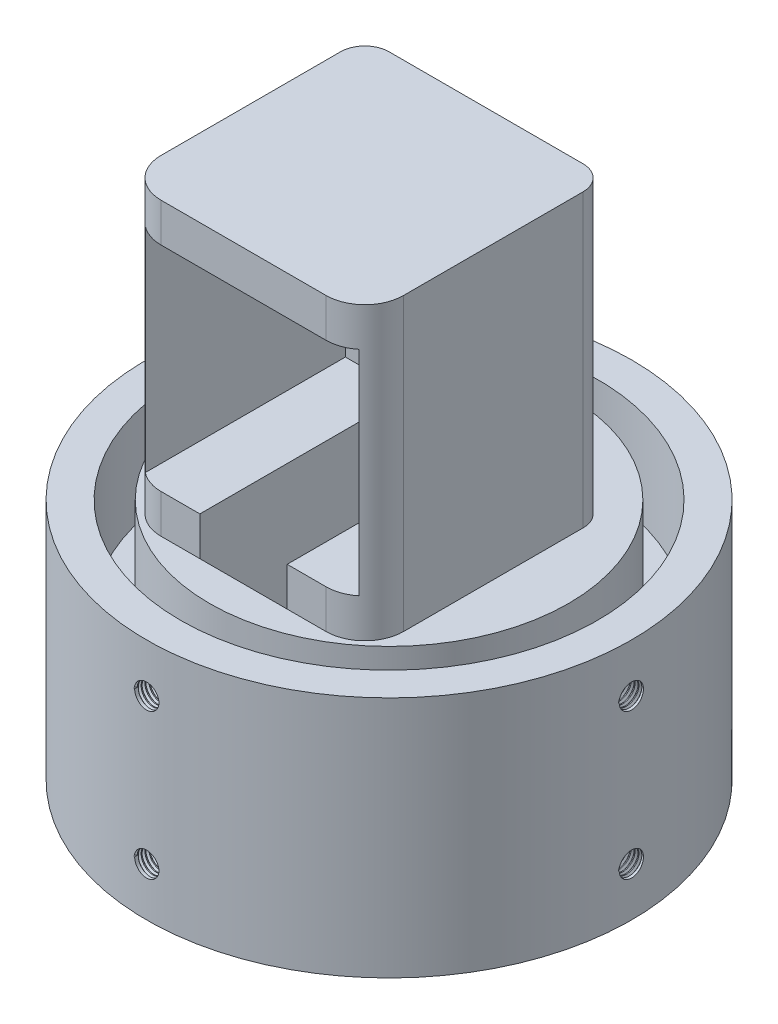
from build123d import *

# Parameters (mm, degrees)
SKETCH1_W                                        = 50
SKETCH1_H                                        = 50
BOSS_EXTRUDE1_DEPTH                              = 60
SKETCH4_W                                        = 44
SKETCH4_H                                        = 44
CUT_EXTRUDE1_DEPTH                               = 43
SKETCH2_R                                        = 50
BOSS_EXTRUDE2_BASE_DEPTH                         = 50
CUT_EXTRUDE3_DEPTH                               = 8
CUT_EXTRUDE3_DEPTH_BACK                          = 1
SKETCH3_M3_LAYOUT_R                              = 11.5
CBORE_FOR_M3_HEX_HEAD_MACHINE_SCREW1_D           = 3.4
CBORE_FOR_M3_HEX_HEAD_MACHINE_SCREW1_CBORE_D     = 8.4
CBORE_FOR_M3_HEX_HEAD_MACHINE_SCREW1_CBORE_DEPTH = 2.3
SKETCH20_W                                       = 18
SKETCH20_H                                       = 43
CUT_EXTRUDE6_WIRE_HOLE_DEPTH                     = 95.281493412
FILLET1_R                                        = 8
FILLET2_R                                        = 5
SKETCH39_PIPE_ALIGNMENT_R                        = 43
SKETCH39_PIPE_ALIGNMENT_R_2                      = 37
CUT_EXTRUDE8_DEPTH                               = 20
SKETCH40_R                                       = 2.5
CUT_EXTRUDE9_DEPTH                               = 11
THREAD1_PITCH                                    = 0.8
THREAD2_PITCH                                    = 0.8
CIRPATTERN6_COUNT                                = 4
THREAD3_PITCH                                    = 0.8
THREAD4_PITCH                                    = 0.8
THREAD6_PITCH                                    = 0.8
THREAD7_PITCH                                    = 0.8
THREAD8_PITCH                                    = 0.8
THREAD9_PITCH                                    = 0.8


with BuildPart() as part:
    # Sketch1 → Boss-Extrude1 (new body)
    with BuildSketch(Plane(origin=(0, 0, 0), x_dir=(1, 0, 0), z_dir=(0, 1, 0))):
        Rectangle(SKETCH1_W, SKETCH1_H)
    extrude(amount=BOSS_EXTRUDE1_DEPTH)

    # Sketch4 → Cut-Extrude1 (cut)
    with BuildSketch(Plane.XY.offset(25)):
        with Locations((0, 30)):
            Rectangle(SKETCH4_W, SKETCH4_H)
    extrude(amount=-CUT_EXTRUDE1_DEPTH, mode=Mode.SUBTRACT)

    # Sketch2 → Boss-Extrude2- Base (add)
    with BuildSketch(Plane(origin=(0, 0, 0), x_dir=(-1, 0, 0), z_dir=(0, -1, 0))):
        with Locations(Location((0, 5, 0), (0, 0, 90))):
            Circle(SKETCH2_R)
    extrude(amount=BOSS_EXTRUDE2_BASE_DEPTH)

    # Sketch3 - M3 Layout → Cut-Extrude3 (cut, two sides: drawn at the far end of the back side and taken through both)
    with BuildSketch(Plane.XY.offset(-25).offset(-CUT_EXTRUDE3_DEPTH_BACK)):
        with Locations((0, 30)):
            Circle(SKETCH3_M3_LAYOUT_R)
    extrude(amount=CUT_EXTRUDE3_DEPTH + CUT_EXTRUDE3_DEPTH_BACK, mode=Mode.SUBTRACT)

    # CBORE for M3 Hex Head Machine Screw1 (through all)
    with Locations(Plane(origin=(0, 0, -25), x_dir=(-1, 0, 0), z_dir=(0, 0, -1))):
        with Locations((-15.5, 45.5), (15.5, 45.5), (15.5, 14.5), (-15.5, 14.5)):
            CounterBoreHole(CBORE_FOR_M3_HEX_HEAD_MACHINE_SCREW1_D / 2, CBORE_FOR_M3_HEX_HEAD_MACHINE_SCREW1_CBORE_D / 2, CBORE_FOR_M3_HEX_HEAD_MACHINE_SCREW1_CBORE_DEPTH)

    # Sketch20 → Cut-Extrude6- Wire Hole (cut, through all)
    with BuildSketch(Plane(origin=(0, 8, 0), x_dir=(1, 0, 0), z_dir=(0, 1, 0))):
        with Locations((0, -3.5)):
            Rectangle(SKETCH20_W, SKETCH20_H)
    extrude(amount=-CUT_EXTRUDE6_WIRE_HOLE_DEPTH, mode=Mode.SUBTRACT)

    # Fillet1
    # the kernel refuses this fillet: 8 mm, written as the material it takes off along each edge
    with BuildSketch(Plane(origin=(25, 0, 25), x_dir=(0, 0, -1), z_dir=(0, 1, 0)), Plane(origin=(-25, 0, 25), x_dir=(1, 0, 0), z_dir=(0, 1, 0))) as fillet1_piece_1:
        with BuildLine():
            CenterArc((FILLET1_R, FILLET1_R), FILLET1_R, 180, 90)
            Line((0, FILLET1_R), (0, 0))
            Line((0, 0), (FILLET1_R, 0))
        make_face()
    extrude(amount=80, mode=Mode.SUBTRACT)

    # Fillet2
    fillet2_edges = [part.edges().sort_by_distance(p)[0] for p in [
        (-25, 30, -25),
        (25, 30, -25),
    ]]
    fillet(fillet2_edges, radius=FILLET2_R)

    # Sketch39- Pipe Alignment → Cut-Extrude8 (cut)
    with BuildSketch(Plane(origin=(0, 0, 0), x_dir=(1, 0, 0), z_dir=(0, 1, 0))):
        with Locations(Location((0, 5, 0), (0, 0, 270))):
            Circle(SKETCH39_PIPE_ALIGNMENT_R)
        with Locations(Location((0, 5, 0), (0, 0, 270))):
            Circle(SKETCH39_PIPE_ALIGNMENT_R_2, mode=Mode.SUBTRACT)
    cut_extrude8 = extrude(amount=-CUT_EXTRUDE8_DEPTH, mode=Mode.SUBTRACT)

    # Mirror1: Cut-Extrude8 across plane
    add(cut_extrude8.mirror(Plane.ZX.offset(-25)), mode=Mode.SUBTRACT)

    # Sketch40 → Cut-Extrude9 (cut)
    with BuildSketch(Plane.XY.offset(45)):
        with Locations(Location((0, -10, 0), (0, 0, 270))):
            Circle(SKETCH40_R)
        with Locations(Location((0, -40, 0), (0, 0, 269.999999966))):
            Circle(SKETCH40_R)
    cut_extrude9 = extrude(amount=-CUT_EXTRUDE9_DEPTH, mode=Mode.SUBTRACT)

    # Thread1: arcs per turn and ends read off the stored shape
    # Thread1: the profile of Thread Profile1 profile screwed along a right-hand helix through 12.5 turns, 8 arcs to a turn; built about Z, then put on its axis
    thread1_z = Axis((0, 0, 0), (0, 0, 1))
    thread1_corners = [(2.4997, 0, -0.000173205), (2.9330127, 0, 0.249999999), (2.9330127, 0, 0.349999999), (2.4997, 0, 0.600173203)]
    with BuildLine(mode=Mode.PRIVATE) as thread1_profile:
        Line(thread1_corners[0], thread1_corners[1])
        Line(thread1_corners[1], thread1_corners[2])
        Line(thread1_corners[2], thread1_corners[3])
        Line(thread1_corners[3], thread1_corners[0])
    thread1_cap = Face(thread1_profile.wire())
    thread1_turn_angles = [0, 22.5, 45, 67.5, 90, 112.5, 135, 157.5, 180, 202.5, 225, 247.5, 270, 292.5, 315, 337.5, 360]
    thread1_turn_weights = [1, 0.9238795325112867, 1, 0.9238795325112867, 1, 0.9238795325112867, 1, 0.9238795325112867, 1, 0.9238795325112867, 1, 0.9238795325112867, 1, 0.9238795325112867, 1, 0.9238795325112867, 1]
    thread1_turn_rails = [Edge.make_bspline([Vector(p[0], p[1], 0).rotate(thread1_z, thread1_turn_angles[k]) / thread1_turn_weights[k] + Vector(0, 0, p[2] + THREAD1_PITCH * thread1_turn_angles[k] / 360) for k in range(17)], [0, 0, 0, 1, 1, 2, 2, 3, 3, 4, 4, 5, 5, 6, 6, 7, 7, 8, 8, 8], 2, thread1_turn_weights) for p in thread1_corners]
    thread1_turn_sides = [Face.make_surface_from_curves(thread1_turn_rails[p[0]], thread1_turn_rails[p[1]]) for p in [(0, 1), (1, 2), (2, 3), (3, 0)]]
    thread1_last_angles = [4320, 4342.5, 4365, 4387.5, 4410, 4432.5, 4455, 4477.5, 4500]
    thread1_last_weights = [1, 0.9238795325112867, 1, 0.9238795325112867, 1, 0.9238795325112867, 1, 0.9238795325112867, 1]
    thread1_last_rails = [Edge.make_bspline([Vector(p[0], p[1], 0).rotate(thread1_z, thread1_last_angles[k]) / thread1_last_weights[k] + Vector(0, 0, p[2] + THREAD1_PITCH * thread1_last_angles[k] / 360) for k in range(9)], [0, 0, 0, 1, 1, 2, 2, 3, 3, 4, 4, 4], 2, thread1_last_weights) for p in thread1_corners]
    thread1_last_sides = [Face.make_surface_from_curves(thread1_last_rails[p[0]], thread1_last_rails[p[1]]) for p in [(0, 1), (1, 2), (2, 3), (3, 0)]]
    thread1 = Plane(origin=(0, -10, 45), x_dir=(-1, 0, 0), z_dir=(0, 0, -1)) * Solid(Shell([*[p.moved(Location((0, 0, THREAD1_PITCH * i))) for i in range(12) for p in thread1_turn_sides], *thread1_last_sides, thread1_cap, thread1_cap.rotate(thread1_z, 4500).moved(Location((0, 0, THREAD1_PITCH * 4500 / 360)))]))
    add(thread1, mode=Mode.SUBTRACT)

    # Thread2: arcs per turn and ends read off the stored shape
    # Thread2: the profile of Thread Profile2 profile screwed along a right-hand helix through 12.5 turns, 8 arcs to a turn; built about Z, then put on its axis
    thread2_z = Axis((0, 0, 0), (0, 0, 1))
    thread2_corners = [(2.4997, 0, -0.000173205), (2.9330127, 0, 0.249999999), (2.9330127, 0, 0.349999999), (2.4997, 0, 0.600173203)]
    with BuildLine(mode=Mode.PRIVATE) as thread2_profile:
        Line(thread2_corners[0], thread2_corners[1])
        Line(thread2_corners[1], thread2_corners[2])
        Line(thread2_corners[2], thread2_corners[3])
        Line(thread2_corners[3], thread2_corners[0])
    thread2_cap = Face(thread2_profile.wire())
    thread2_turn_angles = [0, 22.5, 45, 67.5, 90, 112.5, 135, 157.5, 180, 202.5, 225, 247.5, 270, 292.5, 315, 337.5, 360]
    thread2_turn_weights = [1, 0.9238795325112867, 1, 0.9238795325112867, 1, 0.9238795325112867, 1, 0.9238795325112867, 1, 0.9238795325112867, 1, 0.9238795325112867, 1, 0.9238795325112867, 1, 0.9238795325112867, 1]
    thread2_turn_rails = [Edge.make_bspline([Vector(p[0], p[1], 0).rotate(thread2_z, thread2_turn_angles[k]) / thread2_turn_weights[k] + Vector(0, 0, p[2] + THREAD2_PITCH * thread2_turn_angles[k] / 360) for k in range(17)], [0, 0, 0, 1, 1, 2, 2, 3, 3, 4, 4, 5, 5, 6, 6, 7, 7, 8, 8, 8], 2, thread2_turn_weights) for p in thread2_corners]
    thread2_turn_sides = [Face.make_surface_from_curves(thread2_turn_rails[p[0]], thread2_turn_rails[p[1]]) for p in [(0, 1), (1, 2), (2, 3), (3, 0)]]
    thread2_last_angles = [4320, 4342.5, 4365, 4387.5, 4410, 4432.5, 4455, 4477.5, 4500]
    thread2_last_weights = [1, 0.9238795325112867, 1, 0.9238795325112867, 1, 0.9238795325112867, 1, 0.9238795325112867, 1]
    thread2_last_rails = [Edge.make_bspline([Vector(p[0], p[1], 0).rotate(thread2_z, thread2_last_angles[k]) / thread2_last_weights[k] + Vector(0, 0, p[2] + THREAD2_PITCH * thread2_last_angles[k] / 360) for k in range(9)], [0, 0, 0, 1, 1, 2, 2, 3, 3, 4, 4, 4], 2, thread2_last_weights) for p in thread2_corners]
    thread2_last_sides = [Face.make_surface_from_curves(thread2_last_rails[p[0]], thread2_last_rails[p[1]]) for p in [(0, 1), (1, 2), (2, 3), (3, 0)]]
    thread2 = Plane(origin=(0, -40, 45), x_dir=(-1, 0, 0), z_dir=(0, 0, -1)) * Solid(Shell([*[p.moved(Location((0, 0, THREAD2_PITCH * i))) for i in range(12) for p in thread2_turn_sides], *thread2_last_sides, thread2_cap, thread2_cap.rotate(thread2_z, 4500).moved(Location((0, 0, THREAD2_PITCH * 4500 / 360)))]))
    add(thread2, mode=Mode.SUBTRACT)

    # CirPattern6: Cut-Extrude9 ×4 about axis
    cirpattern6_axis = Axis((0, -50, -5), (0, 1, 0))
    for i in range(1, CIRPATTERN6_COUNT):
        add(cut_extrude9.rotate(cirpattern6_axis, i * 360 / CIRPATTERN6_COUNT), mode=Mode.SUBTRACT)

    # Thread3: arcs per turn and ends read off the stored shape
    # Thread3: the profile of Thread Profile3 profile screwed along a right-hand helix through 12.5 turns, 8 arcs to a turn; built about Z, then put on its axis
    thread3_z = Axis((0, 0, 0), (0, 0, 1))
    thread3_corners = [(2.4997, 0, -0.000173205), (2.9330127, 0, 0.249999999), (2.9330127, 0, 0.349999999), (2.4997, 0, 0.600173203)]
    with BuildLine(mode=Mode.PRIVATE) as thread3_profile:
        Line(thread3_corners[0], thread3_corners[1])
        Line(thread3_corners[1], thread3_corners[2])
        Line(thread3_corners[2], thread3_corners[3])
        Line(thread3_corners[3], thread3_corners[0])
    thread3_cap = Face(thread3_profile.wire())
    thread3_turn_angles = [0, 22.5, 45, 67.5, 90, 112.5, 135, 157.5, 180, 202.5, 225, 247.5, 270, 292.5, 315, 337.5, 360]
    thread3_turn_weights = [1, 0.9238795325112867, 1, 0.9238795325112867, 1, 0.9238795325112867, 1, 0.9238795325112867, 1, 0.9238795325112867, 1, 0.9238795325112867, 1, 0.9238795325112867, 1, 0.9238795325112867, 1]
    thread3_turn_rails = [Edge.make_bspline([Vector(p[0], p[1], 0).rotate(thread3_z, thread3_turn_angles[k]) / thread3_turn_weights[k] + Vector(0, 0, p[2] + THREAD3_PITCH * thread3_turn_angles[k] / 360) for k in range(17)], [0, 0, 0, 1, 1, 2, 2, 3, 3, 4, 4, 5, 5, 6, 6, 7, 7, 8, 8, 8], 2, thread3_turn_weights) for p in thread3_corners]
    thread3_turn_sides = [Face.make_surface_from_curves(thread3_turn_rails[p[0]], thread3_turn_rails[p[1]]) for p in [(0, 1), (1, 2), (2, 3), (3, 0)]]
    thread3_last_angles = [4320, 4342.5, 4365, 4387.5, 4410, 4432.5, 4455, 4477.5, 4500]
    thread3_last_weights = [1, 0.9238795325112867, 1, 0.9238795325112867, 1, 0.9238795325112867, 1, 0.9238795325112867, 1]
    thread3_last_rails = [Edge.make_bspline([Vector(p[0], p[1], 0).rotate(thread3_z, thread3_last_angles[k]) / thread3_last_weights[k] + Vector(0, 0, p[2] + THREAD3_PITCH * thread3_last_angles[k] / 360) for k in range(9)], [0, 0, 0, 1, 1, 2, 2, 3, 3, 4, 4, 4], 2, thread3_last_weights) for p in thread3_corners]
    thread3_last_sides = [Face.make_surface_from_curves(thread3_last_rails[p[0]], thread3_last_rails[p[1]]) for p in [(0, 1), (1, 2), (2, 3), (3, 0)]]
    thread3 = Plane(origin=(50, -10, -5), x_dir=(0, 0, 1), z_dir=(-1, 0, 0)) * Solid(Shell([*[p.moved(Location((0, 0, THREAD3_PITCH * i))) for i in range(12) for p in thread3_turn_sides], *thread3_last_sides, thread3_cap, thread3_cap.rotate(thread3_z, 4500).moved(Location((0, 0, THREAD3_PITCH * 4500 / 360)))]))
    add(thread3, mode=Mode.SUBTRACT)

    # Thread4: arcs per turn and ends read off the stored shape
    # Thread4: the profile of Thread Profile4 profile screwed along a right-hand helix through 12.5 turns, 8 arcs to a turn; built about Z, then put on its axis
    thread4_z = Axis((0, 0, 0), (0, 0, 1))
    thread4_corners = [(2.4997, 0, -0.000173205), (2.9330127, 0, 0.249999999), (2.9330127, 0, 0.349999999), (2.4997, 0, 0.600173203)]
    with BuildLine(mode=Mode.PRIVATE) as thread4_profile:
        Line(thread4_corners[0], thread4_corners[1])
        Line(thread4_corners[1], thread4_corners[2])
        Line(thread4_corners[2], thread4_corners[3])
        Line(thread4_corners[3], thread4_corners[0])
    thread4_cap = Face(thread4_profile.wire())
    thread4_turn_angles = [0, 22.5, 45, 67.5, 90, 112.5, 135, 157.5, 180, 202.5, 225, 247.5, 270, 292.5, 315, 337.5, 360]
    thread4_turn_weights = [1, 0.9238795325112867, 1, 0.9238795325112867, 1, 0.9238795325112867, 1, 0.9238795325112867, 1, 0.9238795325112867, 1, 0.9238795325112867, 1, 0.9238795325112867, 1, 0.9238795325112867, 1]
    thread4_turn_rails = [Edge.make_bspline([Vector(p[0], p[1], 0).rotate(thread4_z, thread4_turn_angles[k]) / thread4_turn_weights[k] + Vector(0, 0, p[2] + THREAD4_PITCH * thread4_turn_angles[k] / 360) for k in range(17)], [0, 0, 0, 1, 1, 2, 2, 3, 3, 4, 4, 5, 5, 6, 6, 7, 7, 8, 8, 8], 2, thread4_turn_weights) for p in thread4_corners]
    thread4_turn_sides = [Face.make_surface_from_curves(thread4_turn_rails[p[0]], thread4_turn_rails[p[1]]) for p in [(0, 1), (1, 2), (2, 3), (3, 0)]]
    thread4_last_angles = [4320, 4342.5, 4365, 4387.5, 4410, 4432.5, 4455, 4477.5, 4500]
    thread4_last_weights = [1, 0.9238795325112867, 1, 0.9238795325112867, 1, 0.9238795325112867, 1, 0.9238795325112867, 1]
    thread4_last_rails = [Edge.make_bspline([Vector(p[0], p[1], 0).rotate(thread4_z, thread4_last_angles[k]) / thread4_last_weights[k] + Vector(0, 0, p[2] + THREAD4_PITCH * thread4_last_angles[k] / 360) for k in range(9)], [0, 0, 0, 1, 1, 2, 2, 3, 3, 4, 4, 4], 2, thread4_last_weights) for p in thread4_corners]
    thread4_last_sides = [Face.make_surface_from_curves(thread4_last_rails[p[0]], thread4_last_rails[p[1]]) for p in [(0, 1), (1, 2), (2, 3), (3, 0)]]
    thread4 = Plane(origin=(50, -40, -5), x_dir=(0, 0, 1), z_dir=(-1, 0, 0)) * Solid(Shell([*[p.moved(Location((0, 0, THREAD4_PITCH * i))) for i in range(12) for p in thread4_turn_sides], *thread4_last_sides, thread4_cap, thread4_cap.rotate(thread4_z, 4500).moved(Location((0, 0, THREAD4_PITCH * 4500 / 360)))]))
    add(thread4, mode=Mode.SUBTRACT)

    # Thread6: arcs per turn and ends read off the stored shape
    # Thread6: the profile of Thread Profile7 profile screwed along a right-hand helix through 12.5 turns, 8 arcs to a turn; built about Z, then put on its axis
    thread6_z = Axis((0, 0, 0), (0, 0, 1))
    thread6_corners = [(2.4997, 0, -0.000173205), (2.9330127, 0, 0.249999999), (2.9330127, 0, 0.349999999), (2.4997, 0, 0.600173203)]
    with BuildLine(mode=Mode.PRIVATE) as thread6_profile:
        Line(thread6_corners[0], thread6_corners[1])
        Line(thread6_corners[1], thread6_corners[2])
        Line(thread6_corners[2], thread6_corners[3])
        Line(thread6_corners[3], thread6_corners[0])
    thread6_cap = Face(thread6_profile.wire())
    thread6_turn_angles = [0, 22.5, 45, 67.5, 90, 112.5, 135, 157.5, 180, 202.5, 225, 247.5, 270, 292.5, 315, 337.5, 360]
    thread6_turn_weights = [1, 0.9238795325112867, 1, 0.9238795325112867, 1, 0.9238795325112867, 1, 0.9238795325112867, 1, 0.9238795325112867, 1, 0.9238795325112867, 1, 0.9238795325112867, 1, 0.9238795325112867, 1]
    thread6_turn_rails = [Edge.make_bspline([Vector(p[0], p[1], 0).rotate(thread6_z, thread6_turn_angles[k]) / thread6_turn_weights[k] + Vector(0, 0, p[2] + THREAD6_PITCH * thread6_turn_angles[k] / 360) for k in range(17)], [0, 0, 0, 1, 1, 2, 2, 3, 3, 4, 4, 5, 5, 6, 6, 7, 7, 8, 8, 8], 2, thread6_turn_weights) for p in thread6_corners]
    thread6_turn_sides = [Face.make_surface_from_curves(thread6_turn_rails[p[0]], thread6_turn_rails[p[1]]) for p in [(0, 1), (1, 2), (2, 3), (3, 0)]]
    thread6_last_angles = [4320, 4342.5, 4365, 4387.5, 4410, 4432.5, 4455, 4477.5, 4500]
    thread6_last_weights = [1, 0.9238795325112867, 1, 0.9238795325112867, 1, 0.9238795325112867, 1, 0.9238795325112867, 1]
    thread6_last_rails = [Edge.make_bspline([Vector(p[0], p[1], 0).rotate(thread6_z, thread6_last_angles[k]) / thread6_last_weights[k] + Vector(0, 0, p[2] + THREAD6_PITCH * thread6_last_angles[k] / 360) for k in range(9)], [0, 0, 0, 1, 1, 2, 2, 3, 3, 4, 4, 4], 2, thread6_last_weights) for p in thread6_corners]
    thread6_last_sides = [Face.make_surface_from_curves(thread6_last_rails[p[0]], thread6_last_rails[p[1]]) for p in [(0, 1), (1, 2), (2, 3), (3, 0)]]
    thread6 = Plane(origin=(0, -10, -55), x_dir=(1, 0, 0), z_dir=(0, 0, 1)) * Solid(Shell([*[p.moved(Location((0, 0, THREAD6_PITCH * i))) for i in range(12) for p in thread6_turn_sides], *thread6_last_sides, thread6_cap, thread6_cap.rotate(thread6_z, 4500).moved(Location((0, 0, THREAD6_PITCH * 4500 / 360)))]))
    add(thread6, mode=Mode.SUBTRACT)

    # Thread7: arcs per turn and ends read off the stored shape
    # Thread7: the profile of Thread Profile8 profile screwed along a right-hand helix through 12.5 turns, 8 arcs to a turn; built about Z, then put on its axis
    thread7_z = Axis((0, 0, 0), (0, 0, 1))
    thread7_corners = [(2.4997, 0, -0.000173205), (2.9330127, 0, 0.249999999), (2.9330127, 0, 0.349999999), (2.4997, 0, 0.600173203)]
    with BuildLine(mode=Mode.PRIVATE) as thread7_profile:
        Line(thread7_corners[0], thread7_corners[1])
        Line(thread7_corners[1], thread7_corners[2])
        Line(thread7_corners[2], thread7_corners[3])
        Line(thread7_corners[3], thread7_corners[0])
    thread7_cap = Face(thread7_profile.wire())
    thread7_turn_angles = [0, 22.5, 45, 67.5, 90, 112.5, 135, 157.5, 180, 202.5, 225, 247.5, 270, 292.5, 315, 337.5, 360]
    thread7_turn_weights = [1, 0.9238795325112867, 1, 0.9238795325112867, 1, 0.9238795325112867, 1, 0.9238795325112867, 1, 0.9238795325112867, 1, 0.9238795325112867, 1, 0.9238795325112867, 1, 0.9238795325112867, 1]
    thread7_turn_rails = [Edge.make_bspline([Vector(p[0], p[1], 0).rotate(thread7_z, thread7_turn_angles[k]) / thread7_turn_weights[k] + Vector(0, 0, p[2] + THREAD7_PITCH * thread7_turn_angles[k] / 360) for k in range(17)], [0, 0, 0, 1, 1, 2, 2, 3, 3, 4, 4, 5, 5, 6, 6, 7, 7, 8, 8, 8], 2, thread7_turn_weights) for p in thread7_corners]
    thread7_turn_sides = [Face.make_surface_from_curves(thread7_turn_rails[p[0]], thread7_turn_rails[p[1]]) for p in [(0, 1), (1, 2), (2, 3), (3, 0)]]
    thread7_last_angles = [4320, 4342.5, 4365, 4387.5, 4410, 4432.5, 4455, 4477.5, 4500]
    thread7_last_weights = [1, 0.9238795325112867, 1, 0.9238795325112867, 1, 0.9238795325112867, 1, 0.9238795325112867, 1]
    thread7_last_rails = [Edge.make_bspline([Vector(p[0], p[1], 0).rotate(thread7_z, thread7_last_angles[k]) / thread7_last_weights[k] + Vector(0, 0, p[2] + THREAD7_PITCH * thread7_last_angles[k] / 360) for k in range(9)], [0, 0, 0, 1, 1, 2, 2, 3, 3, 4, 4, 4], 2, thread7_last_weights) for p in thread7_corners]
    thread7_last_sides = [Face.make_surface_from_curves(thread7_last_rails[p[0]], thread7_last_rails[p[1]]) for p in [(0, 1), (1, 2), (2, 3), (3, 0)]]
    thread7 = Plane(origin=(0, -40, -55), x_dir=(1, 0, 0), z_dir=(0, 0, 1)) * Solid(Shell([*[p.moved(Location((0, 0, THREAD7_PITCH * i))) for i in range(12) for p in thread7_turn_sides], *thread7_last_sides, thread7_cap, thread7_cap.rotate(thread7_z, 4500).moved(Location((0, 0, THREAD7_PITCH * 4500 / 360)))]))
    add(thread7, mode=Mode.SUBTRACT)

    # Thread8: arcs per turn and ends read off the stored shape
    # Thread8: the profile of Thread Profile9 profile screwed along a right-hand helix through 12.5 turns, 8 arcs to a turn; built about Z, then put on its axis
    thread8_z = Axis((0, 0, 0), (0, 0, 1))
    thread8_corners = [(2.4997, 0, -0.000173205), (2.9330127, 0, 0.249999999), (2.9330127, 0, 0.349999999), (2.4997, 0, 0.600173203)]
    with BuildLine(mode=Mode.PRIVATE) as thread8_profile:
        Line(thread8_corners[0], thread8_corners[1])
        Line(thread8_corners[1], thread8_corners[2])
        Line(thread8_corners[2], thread8_corners[3])
        Line(thread8_corners[3], thread8_corners[0])
    thread8_cap = Face(thread8_profile.wire())
    thread8_turn_angles = [0, 22.5, 45, 67.5, 90, 112.5, 135, 157.5, 180, 202.5, 225, 247.5, 270, 292.5, 315, 337.5, 360]
    thread8_turn_weights = [1, 0.9238795325112867, 1, 0.9238795325112867, 1, 0.9238795325112867, 1, 0.9238795325112867, 1, 0.9238795325112867, 1, 0.9238795325112867, 1, 0.9238795325112867, 1, 0.9238795325112867, 1]
    thread8_turn_rails = [Edge.make_bspline([Vector(p[0], p[1], 0).rotate(thread8_z, thread8_turn_angles[k]) / thread8_turn_weights[k] + Vector(0, 0, p[2] + THREAD8_PITCH * thread8_turn_angles[k] / 360) for k in range(17)], [0, 0, 0, 1, 1, 2, 2, 3, 3, 4, 4, 5, 5, 6, 6, 7, 7, 8, 8, 8], 2, thread8_turn_weights) for p in thread8_corners]
    thread8_turn_sides = [Face.make_surface_from_curves(thread8_turn_rails[p[0]], thread8_turn_rails[p[1]]) for p in [(0, 1), (1, 2), (2, 3), (3, 0)]]
    thread8_last_angles = [4320, 4342.5, 4365, 4387.5, 4410, 4432.5, 4455, 4477.5, 4500]
    thread8_last_weights = [1, 0.9238795325112867, 1, 0.9238795325112867, 1, 0.9238795325112867, 1, 0.9238795325112867, 1]
    thread8_last_rails = [Edge.make_bspline([Vector(p[0], p[1], 0).rotate(thread8_z, thread8_last_angles[k]) / thread8_last_weights[k] + Vector(0, 0, p[2] + THREAD8_PITCH * thread8_last_angles[k] / 360) for k in range(9)], [0, 0, 0, 1, 1, 2, 2, 3, 3, 4, 4, 4], 2, thread8_last_weights) for p in thread8_corners]
    thread8_last_sides = [Face.make_surface_from_curves(thread8_last_rails[p[0]], thread8_last_rails[p[1]]) for p in [(0, 1), (1, 2), (2, 3), (3, 0)]]
    thread8 = Plane(origin=(-52, -10, -5), x_dir=(0, 0, -1), z_dir=(1, 0, 0)) * Solid(Shell([*[p.moved(Location((0, 0, THREAD8_PITCH * i))) for i in range(12) for p in thread8_turn_sides], *thread8_last_sides, thread8_cap, thread8_cap.rotate(thread8_z, 4500).moved(Location((0, 0, THREAD8_PITCH * 4500 / 360)))]))
    add(thread8, mode=Mode.SUBTRACT)

    # Thread9: arcs per turn and ends read off the stored shape
    # Thread9: the profile of Thread Profile10 profile screwed along a right-hand helix through 12.5 turns, 8 arcs to a turn; built about Z, then put on its axis
    thread9_z = Axis((0, 0, 0), (0, 0, 1))
    thread9_corners = [(2.4997, 0, -0.000173205), (2.9330127, 0, 0.249999999), (2.9330127, 0, 0.349999999), (2.4997, 0, 0.600173203)]
    with BuildLine(mode=Mode.PRIVATE) as thread9_profile:
        Line(thread9_corners[0], thread9_corners[1])
        Line(thread9_corners[1], thread9_corners[2])
        Line(thread9_corners[2], thread9_corners[3])
        Line(thread9_corners[3], thread9_corners[0])
    thread9_cap = Face(thread9_profile.wire())
    thread9_turn_angles = [0, 22.5, 45, 67.5, 90, 112.5, 135, 157.5, 180, 202.5, 225, 247.5, 270, 292.5, 315, 337.5, 360]
    thread9_turn_weights = [1, 0.9238795325112867, 1, 0.9238795325112867, 1, 0.9238795325112867, 1, 0.9238795325112867, 1, 0.9238795325112867, 1, 0.9238795325112867, 1, 0.9238795325112867, 1, 0.9238795325112867, 1]
    thread9_turn_rails = [Edge.make_bspline([Vector(p[0], p[1], 0).rotate(thread9_z, thread9_turn_angles[k]) / thread9_turn_weights[k] + Vector(0, 0, p[2] + THREAD9_PITCH * thread9_turn_angles[k] / 360) for k in range(17)], [0, 0, 0, 1, 1, 2, 2, 3, 3, 4, 4, 5, 5, 6, 6, 7, 7, 8, 8, 8], 2, thread9_turn_weights) for p in thread9_corners]
    thread9_turn_sides = [Face.make_surface_from_curves(thread9_turn_rails[p[0]], thread9_turn_rails[p[1]]) for p in [(0, 1), (1, 2), (2, 3), (3, 0)]]
    thread9_last_angles = [4320, 4342.5, 4365, 4387.5, 4410, 4432.5, 4455, 4477.5, 4500]
    thread9_last_weights = [1, 0.9238795325112867, 1, 0.9238795325112867, 1, 0.9238795325112867, 1, 0.9238795325112867, 1]
    thread9_last_rails = [Edge.make_bspline([Vector(p[0], p[1], 0).rotate(thread9_z, thread9_last_angles[k]) / thread9_last_weights[k] + Vector(0, 0, p[2] + THREAD9_PITCH * thread9_last_angles[k] / 360) for k in range(9)], [0, 0, 0, 1, 1, 2, 2, 3, 3, 4, 4, 4], 2, thread9_last_weights) for p in thread9_corners]
    thread9_last_sides = [Face.make_surface_from_curves(thread9_last_rails[p[0]], thread9_last_rails[p[1]]) for p in [(0, 1), (1, 2), (2, 3), (3, 0)]]
    thread9 = Plane(origin=(-52, -40, -5), x_dir=(0, 0, -1), z_dir=(1, 0, 0)) * Solid(Shell([*[p.moved(Location((0, 0, THREAD9_PITCH * i))) for i in range(12) for p in thread9_turn_sides], *thread9_last_sides, thread9_cap, thread9_cap.rotate(thread9_z, 4500).moved(Location((0, 0, THREAD9_PITCH * 4500 / 360)))]))
    add(thread9, mode=Mode.SUBTRACT)


solid = part.part
